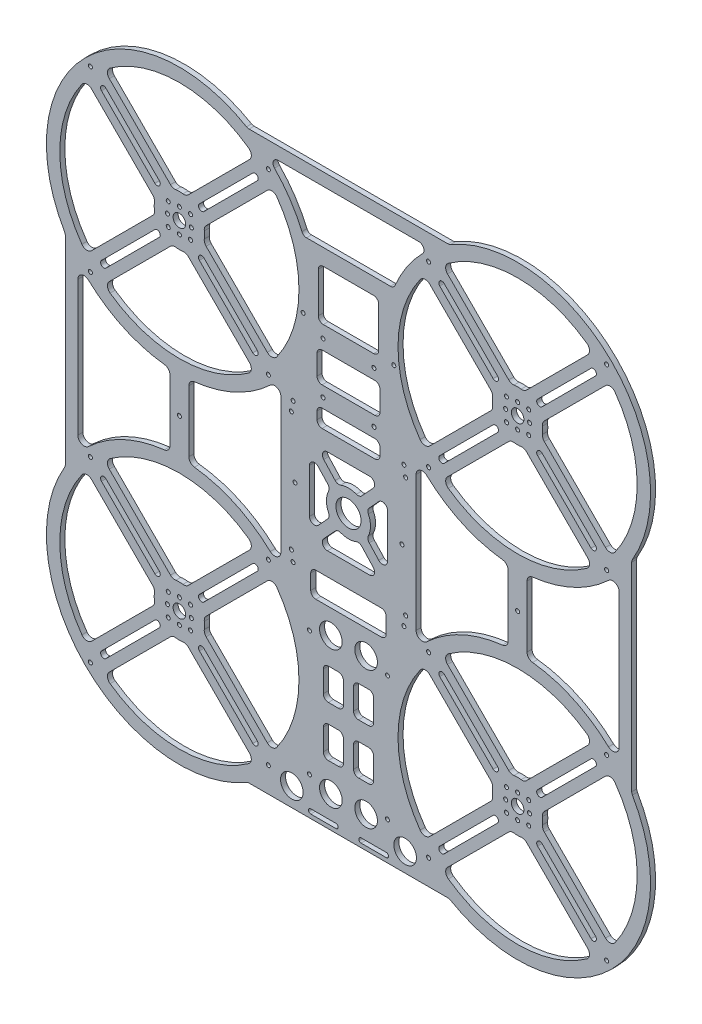
from build123d import *

# Parameters (mm, degrees)
SKETCH_1_W           = 310
SKETCH_1_H           = 310
EXTRUDE_1_DEPTH      = 4
SKETCH_2_R           = 5
SKETCH_2_R_2         = 1.6
CUT_EXTRUDE_2_DEPTH  = 4
SKETCH_3_R           = 2.5
CUT_EXTRUDE_3_DEPTH  = 4
SKETCH_4_R           = 10
CUT_EXTRUDE_4_DEPTH  = 10
SKETCH_5_R           = 1.6
CUT_EXTRUDE_5_DEPTH  = 10
SKETCH_7_R           = 1.6
CUT_EXTRUDE_7_DEPTH  = 10
EXTRUDE_2_DEPTH      = 4
EXTRUDE_3_DEPTH      = 4
CUT_EXTRUDE_12_DEPTH = 6
EXTRUDE_4_DEPTH      = 4
SKETCH_19_R          = 1.6
CUT_EXTRUDE_13_DEPTH = 6
SKETCH_20_R          = 1.6
CUT_EXTRUDE_14_DEPTH = 10
CUT_EXTRUDE_15_DEPTH = 10
FILLET_1_R           = 5
CUT_EXTRUDE_16_DEPTH = 10
CUT_EXTRUDE_17_DEPTH = 5
SKETCH_26_R          = 1.6
CUT_EXTRUDE_18_DEPTH = 10
SKETCH_27_R          = 1.6
SKETCH_27_R_2        = 9
SKETCH_27_W          = 40
SKETCH_27_H          = 25
SKETCH_27_W_2        = 60
SKETCH_27_H_2        = 20
CUT_EXTRUDE_19_DEPTH = 10
FILLET_3_R           = 4
CUT_EXTRUDE_21_DEPTH = 10
SKETCH_30_W          = 8
SKETCH_30_H          = 65
EXTRUDE_5_DEPTH      = 4
FILLET_4_R           = 4
SKETCH_31_W          = 50
SKETCH_31_H          = 24
SKETCH_31_W_2        = 48
SKETCH_31_H_2        = 40
SKETCH_31_H_3        = 14
CUT_EXTRUDE_22_DEPTH = 4
FILLET_5_R           = 4
FILLET_6_R           = 4
FILLET_7_R           = 4
FILLET_8_R           = 4
SKETCH_32_R          = 1.6
CUT_EXTRUDE_23_DEPTH = 10
SKETCH_33_R          = 1.6
CUT_EXTRUDE_24_DEPTH = 4


with BuildPart() as part:
    # 草图1 → 凸台-拉伸1 (new body)
    with BuildSketch(Plane.XY):
        Rectangle(SKETCH_1_W, SKETCH_1_H)
    extrude(amount=EXTRUDE_1_DEPTH)

    # 草图2 → 切除-拉伸2 (cut)
    with BuildSketch(Plane.XY.offset(4)):
        with Locations((-134.350288425, -134.350288425)):
            Circle(SKETCH_2_R)
        with Locations((-134.350288425, -143.850288425)):
            Circle(SKETCH_2_R_2)
        with Locations((-143.850288425, -134.350288425)):
            Circle(SKETCH_2_R_2)
        with Locations((-134.350288425, -124.850288425)):
            Circle(SKETCH_2_R_2)
        with Locations((-124.850288425, -134.350288425)):
            Circle(SKETCH_2_R_2)
        with Locations(Location((124.850288425, -134.350288425, 0), (0, 0, 180))):
            Circle(SKETCH_2_R_2)
        with Locations(Location((134.350288425, -124.850288425, 0), (0, 0, 180))):
            Circle(SKETCH_2_R_2)
        with Locations(Location((143.850288425, -134.350288425, 0), (0, 0, 180))):
            Circle(SKETCH_2_R_2)
        with Locations(Location((134.350288425, -143.850288425, 0), (0, 0, 180))):
            Circle(SKETCH_2_R_2)
        with Locations(Location((134.350288425, -134.350288425, 0), (0, 0, 180))):
            Circle(SKETCH_2_R)
        with Locations((134.350288425, 134.350288425)):
            Circle(SKETCH_2_R)
        with Locations((134.350288425, 143.850288425)):
            Circle(SKETCH_2_R_2)
        with Locations((143.850288425, 134.350288425)):
            Circle(SKETCH_2_R_2)
        with Locations((134.350288425, 124.850288425)):
            Circle(SKETCH_2_R_2)
        with Locations((124.850288425, 134.350288425)):
            Circle(SKETCH_2_R_2)
        with Locations(Location((-124.850288425, 134.350288425, 0), (0, 0, 180))):
            Circle(SKETCH_2_R_2)
        with Locations(Location((-134.350288425, 124.850288425, 0), (0, 0, 180))):
            Circle(SKETCH_2_R_2)
        with Locations(Location((-143.850288425, 134.350288425, 0), (0, 0, 180))):
            Circle(SKETCH_2_R_2)
        with Locations(Location((-134.350288425, 143.850288425, 0), (0, 0, 180))):
            Circle(SKETCH_2_R_2)
        with Locations(Location((-134.350288425, 134.350288425, 0), (0, 0, 180))):
            Circle(SKETCH_2_R)
    extrude(amount=-CUT_EXTRUDE_2_DEPTH, mode=Mode.SUBTRACT)

    # 草图3 → 切除-拉伸3 (cut)
    with BuildSketch(Plane.XY.offset(4)):
        Circle(SKETCH_3_R)
    extrude(amount=-CUT_EXTRUDE_3_DEPTH, mode=Mode.SUBTRACT)

    # 草图4 → 切除-拉伸4 (cut)
    with BuildSketch(Plane.XY.offset(4)):
        Circle(SKETCH_4_R)
    extrude(amount=-CUT_EXTRUDE_4_DEPTH, mode=Mode.SUBTRACT)

    # 草图5 → 切除-拉伸5 (cut)
    with BuildSketch(Plane.XY.offset(4)):
        with Locations((-42.5, 0)):
            Circle(SKETCH_5_R)
        with Locations((42.5, 0)):
            Circle(SKETCH_5_R)
    extrude(amount=-CUT_EXTRUDE_5_DEPTH, mode=Mode.SUBTRACT)

    # 草图7 → 切除-拉伸7 (cut)
    with BuildSketch(Plane.XY.offset(4)):
        with Locations((-45.4, 47.5)):
            Circle(SKETCH_7_R)
        with Locations((-45.4, -47.5)):
            Circle(SKETCH_7_R)
        with Locations((45.4, -47.5)):
            Circle(SKETCH_7_R)
        with Locations((45.4, 47.5)):
            Circle(SKETCH_7_R)
    extrude(amount=-CUT_EXTRUDE_7_DEPTH, mode=Mode.SUBTRACT)

    # 草图10 → 凸台-拉伸2 (add)
    with BuildSketch(Plane.XY.offset(4)):
        with BuildLine():
            ThreePointArc((-30.738267078, 155), (-209.05591591, 209.05591591), (-155, 30.738267078))
            Line((-155, 30.738267078), (-155, 41.621709164))
            ThreePointArc((-155, 41.621709164), (-201.525432638, 201.525432638), (-41.621709164, 155))
            Line((-41.621709164, 155), (-30.738267078, 155))
        make_face()
        with BuildLine():
            Line((-155, 41.621709164), (-155, 30.738267078))
            ThreePointArc((-155, 30.738267078), (-67.341984896, 52.669514593), (-28.700576851, 134.350288425))
            ThreePointArc((-28.700576851, 134.350288425), (-29.211233534, 144.725291673), (-30.738267078, 155))
            Line((-30.738267078, 155), (-41.621709164, 155))
            ThreePointArc((-41.621709164, 155), (-39.919850986, 144.737419168), (-39.350288425, 134.350288425))
            ThreePointArc((-39.350288425, 134.350288425), (-74.922696347, 60.233075176), (-155, 41.621709164))
        make_face()
        with BuildLine():
            ThreePointArc((-155, -30.738267078), (-209.05591591, -209.05591591), (-30.738267078, -155))
            Line((-30.738267078, -155), (-41.621709164, -155))
            ThreePointArc((-41.621709164, -155), (-201.525432638, -201.525432638), (-155, -41.621709164))
            Line((-155, -41.621709164), (-155, -30.738267078))
        make_face()
        with BuildLine():
            Line((-41.621709164, -155), (-30.738267078, -155))
            ThreePointArc((-30.738267078, -155), (-29.211233534, -144.725291673), (-28.700576851, -134.350288425))
            ThreePointArc((-28.700576851, -134.350288425), (-67.341984896, -52.669514593), (-155, -30.738267078))
            Line((-155, -30.738267078), (-155, -41.621709164))
            ThreePointArc((-155, -41.621709164), (-74.922696347, -60.233075176), (-39.350288425, -134.350288425))
            ThreePointArc((-39.350288425, -134.350288425), (-39.919850986, -144.737419168), (-41.621709164, -155))
        make_face()
        with BuildLine():
            ThreePointArc((229.350288425, -134.350288425), (144.737419168, -228.780725864), (41.621709164, -155))
            Line((41.621709164, -155), (30.738267078, -155))
            ThreePointArc((30.738267078, -155), (144.725291673, -239.489343317), (240, -134.350288425))
            ThreePointArc((240, -134.350288425), (216.031062258, -67.341984896), (155, -30.738267078))
            Line((155, -30.738267078), (155, -41.621709164))
            ThreePointArc((155, -41.621709164), (208.467501674, -74.922696347), (229.350288425, -134.350288425))
        make_face()
        with BuildLine():
            Line((30.738267078, -155), (41.621709164, -155))
            ThreePointArc((41.621709164, -155), (67.175144213, -67.175144213), (155, -41.621709164))
            Line((155, -41.621709164), (155, -30.738267078))
            ThreePointArc((155, -30.738267078), (59.644660941, -59.644660941), (30.738267078, -155))
        make_face()
        with BuildLine():
            ThreePointArc((30.738267078, 155), (59.644660941, 59.644660941), (155, 30.738267078))
            Line((155, 30.738267078), (155, 41.621709164))
            ThreePointArc((155, 41.621709164), (67.175144213, 67.175144213), (41.621709164, 155))
            Line((41.621709164, 155), (30.738267078, 155))
        make_face()
        with BuildLine():
            Line((155, 41.621709164), (155, 30.738267078))
            ThreePointArc((155, 30.738267078), (216.031062258, 67.341984896), (240, 134.350288425))
            ThreePointArc((240, 134.350288425), (144.725291673, 239.489343317), (30.738267078, 155))
            Line((30.738267078, 155), (41.621709164, 155))
            ThreePointArc((41.621709164, 155), (144.737419168, 228.780725864), (229.350288425, 134.350288425))
            ThreePointArc((229.350288425, 134.350288425), (208.467501674, 74.922696347), (155, 41.621709164))
        make_face()
    extrude(amount=-EXTRUDE_2_DEPTH)

    # 草图11 → 凸台-拉伸3 (add)
    with BuildSketch(Plane.XY.offset(4)):
        with BuildLine():
            Line((-225, 80.087120924), (-225, -80.087120924))
            ThreePointArc((-225, -80.087120924), (-195.224895137, -48.001323096), (-155, -30.738267078))
            Line((-155, -30.738267078), (-155, 30.738267078))
            ThreePointArc((-155, 30.738267078), (-195.224895137, 48.001323096), (-225, 80.087120924))
        make_face()
        with BuildLine():
            Line((30.738267078, -155), (-30.738267078, -155))
            ThreePointArc((-30.738267078, -155), (-48.001323096, -195.224895137), (-80.087120924, -225))
            Line((-80.087120924, -225), (80.087120924, -225))
            ThreePointArc((80.087120924, -225), (48.001323096, -195.224895137), (30.738267078, -155))
        make_face()
        with BuildLine():
            Line((225, -80.087120924), (225, 80.087120924))
            ThreePointArc((225, 80.087120924), (195.224895137, 48.001323096), (155, 30.738267078))
            Line((155, 30.738267078), (155, -30.738267078))
            ThreePointArc((155, -30.738267078), (195.224895137, -48.001323096), (225, -80.087120924))
        make_face()
        with BuildLine():
            Line((-30.738267078, 155), (30.738267078, 155))
            ThreePointArc((30.738267078, 155), (48.001323096, 195.224895137), (80.087120924, 225))
            Line((80.087120924, 225), (-80.087120924, 225))
            ThreePointArc((-80.087120924, 225), (-48.001323096, 195.224895137), (-30.738267078, 155))
        make_face()
    extrude(amount=-EXTRUDE_3_DEPTH)

    # 草图12 → 切除-拉伸12 (cut)
    with BuildSketch(Plane.XY.offset(4)):
        with BuildLine():
            Line((-74.619410158, -60.477274534), (-129.173907523, -115.0317719))
            ThreePointArc((-129.173907523, -115.0317719), (-148.492424049, -148.492424049), (-115.0317719, -129.173907523))
            Line((-115.0317719, -129.173907523), (-60.477274534, -74.619410158))
            ThreePointArc((-60.477274534, -74.619410158), (-201.525432638, -201.525432638), (-74.619410158, -60.477274534))
        make_face()
        with BuildLine():
            Line((74.619410158, -60.477274534), (129.173907523, -115.0317719))
            ThreePointArc((129.173907523, -115.0317719), (148.492424049, -148.492424049), (115.0317719, -129.173907523))
            Line((115.0317719, -129.173907523), (60.477274534, -74.619410158))
            ThreePointArc((60.477274534, -74.619410158), (201.525432638, -201.525432638), (74.619410158, -60.477274534))
        make_face()
        with BuildLine():
            Line((60.477274534, 74.619410158), (115.0317719, 129.173907523))
            ThreePointArc((115.0317719, 129.173907523), (148.492424049, 148.492424049), (129.173907523, 115.0317719))
            Line((129.173907523, 115.0317719), (74.619410158, 60.477274534))
            ThreePointArc((74.619410158, 60.477274534), (201.525432638, 201.525432638), (60.477274534, 74.619410158))
        make_face()
        with BuildLine():
            Line((-74.619410158, 60.477274534), (-129.173907523, 115.0317719))
            ThreePointArc((-129.173907523, 115.0317719), (-148.492424049, 148.492424049), (-115.0317719, 129.173907523))
            Line((-115.0317719, 129.173907523), (-60.477274534, 74.619410158))
            ThreePointArc((-60.477274534, 74.619410158), (-201.525432638, 201.525432638), (-74.619410158, 60.477274534))
        make_face()
    extrude(amount=-CUT_EXTRUDE_12_DEPTH, mode=Mode.SUBTRACT)

    # 草图15 → 凸台-拉伸4 (add)
    with BuildSketch(Plane.XY.offset(4)):
        with BuildLine():
            Line((194.081166693, -60.477274534), (139.526669327, -115.0317719))
            ThreePointArc((139.526669327, -115.0317719), (148.492424049, -120.208152802), (153.668804951, -129.173907523))
            Line((153.668804951, -129.173907523), (208.223302317, -74.619410158))
            ThreePointArc((208.223302317, -74.619410158), (201.525432638, -67.175144213), (194.081166693, -60.477274534))
        make_face()
        with BuildLine():
            Line((208.223302317, -194.081166693), (153.668804951, -139.526669327))
            ThreePointArc((153.668804951, -139.526669327), (148.492424049, -148.492424049), (139.526669327, -153.668804951))
            Line((139.526669327, -153.668804951), (194.081166693, -208.223302317))
            ThreePointArc((194.081166693, -208.223302317), (201.525432638, -201.525432638), (208.223302317, -194.081166693))
        make_face()
        with BuildLine():
            Line((74.619410158, -208.223302317), (129.173907523, -153.668804951))
            ThreePointArc((129.173907523, -153.668804951), (120.208152802, -148.492424049), (115.0317719, -139.526669327))
            Line((115.0317719, -139.526669327), (60.477274534, -194.081166693))
            ThreePointArc((60.477274534, -194.081166693), (67.175144213, -201.525432638), (74.619410158, -208.223302317))
        make_face()
        with BuildLine():
            Line((-60.477274534, -194.081166693), (-115.0317719, -139.526669327))
            ThreePointArc((-115.0317719, -139.526669327), (-120.208152802, -148.492424049), (-129.173907523, -153.668804951))
            Line((-129.173907523, -153.668804951), (-74.619410158, -208.223302317))
            ThreePointArc((-74.619410158, -208.223302317), (-67.175144213, -201.525432638), (-60.477274534, -194.081166693))
        make_face()
        with BuildLine():
            Line((-194.081166693, -208.223302317), (-139.526669327, -153.668804951))
            ThreePointArc((-139.526669327, -153.668804951), (-148.492424049, -148.492424049), (-153.668804951, -139.526669327))
            Line((-153.668804951, -139.526669327), (-208.223302317, -194.081166693))
            ThreePointArc((-208.223302317, -194.081166693), (-201.525432638, -201.525432638), (-194.081166693, -208.223302317))
        make_face()
        with BuildLine():
            Line((-208.223302317, -74.619410158), (-153.668804951, -129.173907523))
            ThreePointArc((-153.668804951, -129.173907523), (-148.492424049, -120.208152802), (-139.526669327, -115.0317719))
            Line((-139.526669327, -115.0317719), (-194.081166693, -60.477274534))
            ThreePointArc((-194.081166693, -60.477274534), (-201.525432638, -67.175144213), (-208.223302317, -74.619410158))
        make_face()
        with BuildLine():
            Line((-194.081166693, 60.477274534), (-139.526669327, 115.0317719))
            ThreePointArc((-139.526669327, 115.0317719), (-148.492424049, 120.208152802), (-153.668804951, 129.173907523))
            Line((-153.668804951, 129.173907523), (-208.223302317, 74.619410158))
            ThreePointArc((-208.223302317, 74.619410158), (-201.525432638, 67.175144213), (-194.081166693, 60.477274534))
        make_face()
        with BuildLine():
            Line((-208.223302317, 194.081166693), (-153.668804951, 139.526669327))
            ThreePointArc((-153.668804951, 139.526669327), (-148.492424049, 148.492424049), (-139.526669327, 153.668804951))
            Line((-139.526669327, 153.668804951), (-194.081166693, 208.223302317))
            ThreePointArc((-194.081166693, 208.223302317), (-201.525432638, 201.525432638), (-208.223302317, 194.081166693))
        make_face()
        with BuildLine():
            Line((-74.619410158, 208.223302317), (-129.173907523, 153.668804951))
            ThreePointArc((-129.173907523, 153.668804951), (-120.208152802, 148.492424049), (-115.0317719, 139.526669327))
            Line((-115.0317719, 139.526669327), (-60.477274534, 194.081166693))
            ThreePointArc((-60.477274534, 194.081166693), (-67.175144213, 201.525432638), (-74.619410158, 208.223302317))
        make_face()
        with BuildLine():
            Line((60.477274534, 194.081166693), (115.0317719, 139.526669327))
            ThreePointArc((115.0317719, 139.526669327), (120.208152802, 148.492424049), (129.173907523, 153.668804951))
            Line((129.173907523, 153.668804951), (74.619410158, 208.223302317))
            ThreePointArc((74.619410158, 208.223302317), (67.175144213, 201.525432638), (60.477274534, 194.081166693))
        make_face()
        with BuildLine():
            Line((194.081166693, 208.223302317), (139.526669327, 153.668804951))
            ThreePointArc((139.526669327, 153.668804951), (148.492424049, 148.492424049), (153.668804951, 139.526669327))
            Line((153.668804951, 139.526669327), (208.223302317, 194.081166693))
            ThreePointArc((208.223302317, 194.081166693), (201.525432638, 201.525432638), (194.081166693, 208.223302317))
        make_face()
        with BuildLine():
            Line((208.223302317, 74.619410158), (153.668804951, 129.173907523))
            ThreePointArc((153.668804951, 129.173907523), (148.492424049, 120.208152802), (139.526669327, 115.0317719))
            Line((139.526669327, 115.0317719), (194.081166693, 60.477274534))
            ThreePointArc((194.081166693, 60.477274534), (201.525432638, 67.175144213), (208.223302317, 74.619410158))
        make_face()
    extrude(amount=-EXTRUDE_4_DEPTH)

    # 草图19 → 切除-拉伸13 (cut)
    with BuildSketch(Plane.XY.offset(4)):
        with Locations((63.639610307, -63.639610307)):
            Circle(SKETCH_19_R)
        with Locations((205.060966544, -63.639610307)):
            Circle(SKETCH_19_R)
        with Locations((205.060966544, -205.060966544)):
            Circle(SKETCH_19_R)
        with Locations((63.639610307, -205.060966544)):
            Circle(SKETCH_19_R)
        with Locations((-63.639610307, -205.060966544)):
            Circle(SKETCH_19_R)
        with Locations((-205.060966544, -205.060966544)):
            Circle(SKETCH_19_R)
        with Locations((-205.060966544, -63.639610307)):
            Circle(SKETCH_19_R)
        with Locations((-63.639610307, -63.639610307)):
            Circle(SKETCH_19_R)
        with Locations((-63.639610307, 63.639610307)):
            Circle(SKETCH_19_R)
        with Locations((-205.060966544, 63.639610307)):
            Circle(SKETCH_19_R)
        with Locations((-205.060966544, 205.060966544)):
            Circle(SKETCH_19_R)
        with Locations((-63.639610307, 205.060966544)):
            Circle(SKETCH_19_R)
        with Locations((63.639610307, 205.060966544)):
            Circle(SKETCH_19_R)
        with Locations((205.060966544, 205.060966544)):
            Circle(SKETCH_19_R)
        with Locations((205.060966544, 63.639610307)):
            Circle(SKETCH_19_R)
        with Locations((63.639610307, 63.639610307)):
            Circle(SKETCH_19_R)
    extrude(amount=-CUT_EXTRUDE_13_DEPTH, mode=Mode.SUBTRACT)

    # 草图20 → 切除-拉伸14 (cut)
    with BuildSketch(Plane.XY.offset(4)):
        with Locations((-31, -195)):
            Circle(SKETCH_20_R)
        with Locations((-31, -96)):
            Circle(SKETCH_20_R)
        with Locations((31, -195)):
            Circle(SKETCH_20_R)
        with Locations((31, -96)):
            Circle(SKETCH_20_R)
    extrude(amount=-CUT_EXTRUDE_14_DEPTH, mode=Mode.SUBTRACT)

    # 草图21 → 切除-拉伸15 (cut)
    with BuildSketch(Plane.XY.offset(4)):
        with BuildLine():
            Line((-215, 66.104515086), (-215, -66.104515086))
            ThreePointArc((-215, -66.104515086), (-182.176948203, -40.145871489), (-141.850288425, -28.967122997))
            Line((-141.850288425, -28.967122997), (-141.850288425, 28.967122997))
            ThreePointArc((-141.850288425, 28.967122997), (-182.176948203, 40.145871489), (-215, 66.104515086))
        make_face()
        with BuildLine():
            Line((-53.700576851, 66.104515086), (-53.700576851, -66.104515086))
            ThreePointArc((-53.700576851, -66.104515086), (-86.523628648, -40.145871489), (-126.850288425, -28.967122997))
            Line((-126.850288425, -28.967122997), (-126.850288425, 28.967122997))
            ThreePointArc((-126.850288425, 28.967122997), (-86.523628648, 40.145871489), (-53.700576851, 66.104515086))
        make_face()
        with BuildLine():
            Line((126.850288425, 28.967122997), (126.850288425, -28.967122997))
            ThreePointArc((126.850288425, -28.967122997), (86.523628648, -40.145871489), (53.700576851, -66.104515086))
            Line((53.700576851, -66.104515086), (53.700576851, 66.104515086))
            ThreePointArc((53.700576851, 66.104515086), (86.523628648, 40.145871489), (126.850288425, 28.967122997))
        make_face()
        with BuildLine():
            Line((141.850288425, 28.967122997), (141.850288425, -28.967122997))
            ThreePointArc((141.850288425, -28.967122997), (182.176948203, -40.145871489), (215, -66.104515086))
            Line((215, -66.104515086), (215, 66.104515086))
            ThreePointArc((215, 66.104515086), (182.176948203, 40.145871489), (141.850288425, 28.967122997))
        make_face()
    extrude(amount=-CUT_EXTRUDE_15_DEPTH, mode=Mode.SUBTRACT)

    # 圆角1
    # the kernel refuses this fillet: 5 mm, written as the material it adds along each edge
    with BuildSketch(Plane(origin=(-74.619410158, -60.477274534, 4), x_dir=(-0.7967219110090882, 0.6043460900163303, 0), z_dir=(0, 0, -1)), Plane(origin=(-60.477274534, 74.619410158, 4), x_dir=(0.6043460900163303, 0.7967219110090882, 0), z_dir=(0, 0, -1)), Plane(origin=(74.619410158, 60.477274534, 4), x_dir=(0.7967219110090923, -0.604346090016325, 0), z_dir=(0, 0, -1)), Plane(origin=(60.477274534, -74.619410158, 4), x_dir=(-0.6043460900163312, -0.7967219110090877, 0), z_dir=(0, 0, -1)), Plane(origin=(194.081166693, -60.477274534, 4), x_dir=(-0.7967219110091349, 0.6043460900162688, 0), z_dir=(0, 0, -1)), Plane(origin=(208.223302317, -194.081166693, 4), x_dir=(0.6043460900162626, 0.7967219110091395, 0), z_dir=(0, 0, -1)), Plane(origin=(74.619410158, -208.223302317, 4), x_dir=(0.7967219110091152, -0.604346090016295, 0), z_dir=(0, 0, -1)), Plane(origin=(-60.477274534, -194.081166693, 4), x_dir=(0.6043460900162643, 0.7967219110091384, 0), z_dir=(0, 0, -1)), Plane(origin=(-194.081166693, -208.223302317, 4), x_dir=(0.7967219110091337, -0.6043460900162704, 0), z_dir=(0, 0, -1)), Plane(origin=(-208.223302317, -74.619410158, 4), x_dir=(-0.6043460900163309, -0.796721911009088, 0), z_dir=(0, 0, -1)), Plane(origin=(-194.081166693, 60.477274534, 4), x_dir=(0.796721911009097, -0.6043460900163189, 0), z_dir=(0, 0, -1)), Plane(origin=(-208.223302317, 194.081166693, 4), x_dir=(-0.6043460900162841, -0.7967219110091232, 0), z_dir=(0, 0, -1)), Plane(origin=(-74.619410158, 208.223302317, 4), x_dir=(-0.796721911009138, 0.6043460900162645, 0), z_dir=(0, 0, -1)), Plane(origin=(60.477274534, 194.081166693, 4), x_dir=(-0.6043460900163381, -0.7967219110090824, 0), z_dir=(0, 0, -1)), Plane(origin=(194.081166693, 208.223302317, 4), x_dir=(-0.796721911009126, 0.6043460900162804, 0), z_dir=(0, 0, -1)), Plane(origin=(208.223302317, 74.619410158, 4), x_dir=(0.6043460900162649, 0.7967219110091378, 0), z_dir=(0, 0, -1))) as fillet_1_piece_1:
        with BuildLine():
            CenterArc((5.733115681, -4.997598502), FILLET_1_R, 88.224130096, 99.594068227)
            Line((0.779592259, -5.67774974), (0, 0))
            ThreePointArc((0, 0), (2.944032377, 0.045628466), (5.888064753, 0))
        make_face()
    extrude(amount=4)
    with BuildSketch(Plane(origin=(-129.173907523, -115.0317719, 4), x_dir=(0.7071067811865476, 0.7071067811865476, 0), z_dir=(0, 0, -1)), Plane(origin=(-115.0317719, 129.173907523, 4), x_dir=(0.7071067811865476, -0.7071067811865476, 0), z_dir=(0, 0, -1)), Plane(origin=(129.173907523, 115.0317719, 4), x_dir=(-0.7071067811865476, -0.7071067811865476, 0), z_dir=(0, 0, -1)), Plane(origin=(115.0317719, -129.173907523, 4), x_dir=(-0.7071067811865449, 0.7071067811865501, 0), z_dir=(0, 0, -1))) as fillet_1_piece_2:
        with BuildLine():
            CenterArc((2.679491924, -5), FILLET_1_R, 90, 53.130102354)
            ThreePointArc((-1.320508076, -2), (-0.630269473, -1.01979743), (0, 0))
            Line((0, 0), (2.679491924, 0))
        make_face()
    extrude(amount=4)
    with BuildSketch(Plane(origin=(-115.0317719, -129.173907523, 4), x_dir=(0.7071067811865529, 0.7071067811865422, 0), z_dir=(0, 0, -1)), Plane(origin=(-129.173907523, 115.0317719, 4), x_dir=(0.7071067811865448, -0.7071067811865501, 0), z_dir=(0, 0, -1)), Plane(origin=(115.0317719, 129.173907523, 4), x_dir=(-0.7071067811865529, -0.7071067811865422, 0), z_dir=(0, 0, -1)), Plane(origin=(129.173907523, -115.0317719, 4), x_dir=(-0.7071067811865476, 0.7071067811865476, 0), z_dir=(0, 0, -1)), Plane(origin=(-115.0317719, 139.526669327, 4), x_dir=(0.7071067811865608, 0.7071067811865343, 0), z_dir=(0, 0, -1))) as fillet_1_piece_3:
        with BuildLine():
            CenterArc((2.679491924, 5), FILLET_1_R, 216.869897646, 53.130102354)
            ThreePointArc((-1.320508076, 2), (-0.630269473, 1.01979743), (0, 0))
            Line((0, 0), (2.679491924, 0))
        make_face()
    extrude(amount=4)
    with BuildSketch(Plane(origin=(-60.477274534, -74.619410158, 4), x_dir=(0.6043460900163297, -0.7967219110090887, 0), z_dir=(0, 0, -1)), Plane(origin=(-74.619410158, 60.477274534, 4), x_dir=(-0.7967219110090935, -0.6043460900163236, 0), z_dir=(0, 0, -1)), Plane(origin=(60.477274534, 74.619410158, 4), x_dir=(-0.6043460900163317, 0.7967219110090873, 0), z_dir=(0, 0, -1)), Plane(origin=(74.619410158, -60.477274534, 4), x_dir=(0.7967219110090923, 0.604346090016325, 0), z_dir=(0, 0, -1)), Plane(origin=(208.223302317, -74.619410158, 4), x_dir=(0.6043460900162811, -0.7967219110091256, 0), z_dir=(0, 0, -1)), Plane(origin=(194.081166693, -208.223302317, 4), x_dir=(-0.7967219110091273, -0.6043460900162788, 0), z_dir=(0, 0, -1)), Plane(origin=(60.477274534, -194.081166693, 4), x_dir=(-0.6043460900163019, 0.7967219110091098, 0), z_dir=(0, 0, -1)), Plane(origin=(-74.619410158, -208.223302317, 4), x_dir=(-0.7967219110091455, -0.6043460900162549, 0), z_dir=(0, 0, -1)), Plane(origin=(-208.223302317, -194.081166693, 4), x_dir=(-0.6043460900162757, 0.7967219110091296, 0), z_dir=(0, 0, -1)), Plane(origin=(-194.081166693, -60.477274534, 4), x_dir=(0.7967219110090976, 0.6043460900163181, 0), z_dir=(0, 0, -1)), Plane(origin=(-208.223302317, 74.619410158, 4), x_dir=(-0.6043460900163242, 0.7967219110090928, 0), z_dir=(0, 0, -1)), Plane(origin=(-194.081166693, 208.223302317, 4), x_dir=(0.7967219110091238, 0.6043460900162835, 0), z_dir=(0, 0, -1)), Plane(origin=(-60.477274534, 194.081166693, 4), x_dir=(0.604346090016268, -0.7967219110091355, 0), z_dir=(0, 0, -1)), Plane(origin=(74.619410158, 208.223302317, 4), x_dir=(0.7967219110090917, 0.6043460900163258, 0), z_dir=(0, 0, -1)), Plane(origin=(208.223302317, 194.081166693, 4), x_dir=(0.6043460900162664, -0.7967219110091366, 0), z_dir=(0, 0, -1)), Plane(origin=(194.081166693, 60.477274534, 4), x_dir=(-0.7967219110091525, -0.6043460900162457, 0), z_dir=(0, 0, -1))) as fillet_1_piece_4:
        with BuildLine():
            CenterArc((5.733115681, 4.997598502), FILLET_1_R, 172.181801677, 99.594068227)
            Line((0.779592259, 5.67774974), (0, 0))
            ThreePointArc((0, 0), (2.944032377, -0.045628466), (5.888064753, 0))
        make_face()
    extrude(amount=4)
    with BuildSketch(Plane(origin=(153.668804951, -129.173907523, 4), x_dir=(0.20048037027259313, -0.9796977192661848, 0), z_dir=(0, 0, -1)), Plane(origin=(139.526669327, -153.668804951, 4), x_dir=(-0.9796977192661612, -0.20048037027270718, 0), z_dir=(0, 0, -1)), Plane(origin=(-129.173907523, -153.668804951, 4), x_dir=(-0.9796977192661944, -0.20048037027254526, 0), z_dir=(0, 0, -1)), Plane(origin=(-153.668804951, -139.526669327, 4), x_dir=(-0.200480370272568, 0.9796977192661898, 0), z_dir=(0, 0, -1)), Plane(origin=(-139.526669327, -115.0317719, 4), x_dir=(0.9796977192661748, 0.20048037027264123, 0), z_dir=(0, 0, -1)), Plane(origin=(-153.668804951, 129.173907523, 4), x_dir=(-0.20048037027270513, 0.9796977192661617, 0), z_dir=(0, 0, -1)), Plane(origin=(-139.526669327, 153.668804951, 4), x_dir=(0.9796977192661659, 0.20048037027268442, 0), z_dir=(0, 0, -1)), Plane(origin=(129.173907523, 153.668804951, 4), x_dir=(0.9796977192661748, 0.20048037027264123, 0), z_dir=(0, 0, -1)), Plane(origin=(153.668804951, 139.526669327, 4), x_dir=(0.20048037027250878, -0.979697719266202, 0), z_dir=(0, 0, -1)), Plane(origin=(139.526669327, 115.0317719, 4), x_dir=(-0.9796977192661965, -0.2004803702725349, 0), z_dir=(0, 0, -1))) as fillet_1_piece_5:
        with BuildLine():
            CenterArc((2.69618674, -4.991017335), FILLET_1_R, 93.434948823, 53.130102354)
            Line((-1.476372911, -2.236067977), (0, 0))
            ThreePointArc((0, 0), (1.198305218, -0.03593066), (2.396610435, 0))
        make_face()
    extrude(amount=4)
    with BuildSketch(Plane(origin=(139.526669327, -115.0317719, 4), x_dir=(-0.9796977192662006, 0.2004803702725155, 0), z_dir=(0, 0, -1)), Plane(origin=(153.668804951, -139.526669327, 4), x_dir=(0.20048037027249271, 0.9796977192662051, 0), z_dir=(0, 0, -1)), Plane(origin=(129.173907523, -153.668804951, 4), x_dir=(0.9796977192661716, -0.20048037027265728, 0), z_dir=(0, 0, -1)), Plane(origin=(-115.0317719, -139.526669327, 4), x_dir=(0.20048037027268442, 0.9796977192661659, 0), z_dir=(0, 0, -1)), Plane(origin=(-139.526669327, -153.668804951, 4), x_dir=(0.9796977192661739, -0.20048037027264562, 0), z_dir=(0, 0, -1)), Plane(origin=(-153.668804951, -129.173907523, 4), x_dir=(-0.20048037027269142, -0.9796977192661644, 0), z_dir=(0, 0, -1)), Plane(origin=(-139.526669327, 115.0317719, 4), x_dir=(0.9796977192661752, -0.20048037027263887, 0), z_dir=(0, 0, -1)), Plane(origin=(-153.668804951, 139.526669327, 4), x_dir=(-0.20048037027258173, -0.9796977192661869, 0), z_dir=(0, 0, -1)), Plane(origin=(-129.173907523, 153.668804951, 4), x_dir=(-0.9796977192661869, 0.20048037027258173, 0), z_dir=(0, 0, -1)), Plane(origin=(139.526669327, 153.668804951, 4), x_dir=(-0.9796977192661666, 0.20048037027268212, 0), z_dir=(0, 0, -1)), Plane(origin=(153.668804951, 129.173907523, 4), x_dir=(0.20048037027261822, 0.9796977192661797, 0), z_dir=(0, 0, -1))) as fillet_1_piece_6:
        with BuildLine():
            CenterArc((2.69618674, 4.991017335), FILLET_1_R, 213.434948823, 53.130102354)
            Line((-1.476372911, 2.236067977), (0, 0))
            ThreePointArc((0, 0), (1.198305218, 0.03593066), (2.396610435, 0))
        make_face()
    extrude(amount=4)
    with BuildSketch(Plane(origin=(115.0317719, -139.526669327, 4), x_dir=(-0.2004803702727988, 0.9796977192661427, 0), z_dir=(0, 0, -1))) as fillet_1_piece_7:
        with BuildLine():
            CenterArc((2.69618674, -4.991017335), FILLET_1_R, 93.434948823, 53.130102354)
            Line((-1.476372911, -2.236067978), (0, 0))
            ThreePointArc((0, 0), (1.198305218, -0.03593066), (2.396610435, 0))
        make_face()
    extrude(amount=4)
    with BuildSketch(Plane(origin=(115.0317719, 139.526669327, 4), x_dir=(-0.20048037027278273, -0.9796977192661459, 0), z_dir=(0, 0, -1))) as fillet_1_piece_8:
        with BuildLine():
            CenterArc((2.69618674, 4.991017335), FILLET_1_R, 213.434948823, 53.130102354)
            Line((-1.476372911, 2.236067978), (0, 0))
            ThreePointArc((0, 0), (1.198305218, 0.03593066), (2.396610435, 0))
        make_face()
    extrude(amount=4)
    with BuildSketch(Plane(origin=(141.850288425, 28.967122997, 4), x_dir=(0, -1, 0), z_dir=(0, 0, -1)), Plane(origin=(-126.850288425, 28.967122997, 4), x_dir=(0, -1, 0), z_dir=(0, 0, -1)), Plane(origin=(-141.850288425, -28.967122997, 4), x_dir=(0, 1, 0), z_dir=(0, 0, -1)), Plane(origin=(126.850288425, -28.967122997, 4), x_dir=(0, 1, 0), z_dir=(0, 0, -1))) as fillet_1_piece_9:
        with BuildLine():
            CenterArc((4.558222008, -5), FILLET_1_R, 90, 83.513499464)
            ThreePointArc((-0.409770492, -4.435154425), (-0.181510162, -2.219736871), (0, 0))
            Line((0, 0), (4.558222008, 0))
        make_face()
    extrude(amount=4)
    with BuildSketch(Plane(origin=(215, 66.104515086, 4), x_dir=(0, -1, 0), z_dir=(0, 0, -1))) as fillet_1_piece_10:
        with BuildLine():
            CenterArc((12.503714648, 5), FILLET_1_R, 136.867606569, 133.132393431)
            ThreePointArc((8.854835367, 8.418432389), (4.549214087, 4.081105989), (0, 0))
            Line((0, 0), (12.503714648, 0))
        make_face()
    extrude(amount=4)
    with BuildSketch(Plane(origin=(215, -66.104515086, 4), x_dir=(0, 1, 0), z_dir=(0, 0, -1)), Plane(origin=(-215, 66.104515086, 4), x_dir=(0, -1, 0), z_dir=(0, 0, -1))) as fillet_1_piece_11:
        with BuildLine():
            CenterArc((12.503714648, -5), FILLET_1_R, 90, 133.132393431)
            ThreePointArc((8.854835367, -8.418432389), (4.549214087, -4.081105989), (0, 0))
            Line((0, 0), (12.503714648, 0))
        make_face()
    extrude(amount=4)
    with BuildSketch(Plane(origin=(141.850288425, -28.967122997, 4), x_dir=(0.9957590389908278, -0.09199965363012458, 0), z_dir=(0, 0, -1)), Plane(origin=(-126.850288425, -28.967122997, 4), x_dir=(0.995759038990828, -0.0919996536301237, 0), z_dir=(0, 0, -1)), Plane(origin=(126.850288425, 28.967122997, 4), x_dir=(-0.9957590389908271, 0.09199965363013249, 0), z_dir=(0, 0, -1))) as fillet_1_piece_12:
        with BuildLine():
            CenterArc((4.559440349, -4.998889034), FILLET_1_R, 91.207844363, 83.513499464)
            Line((-0.419354846, -4.538890766), (0, 0))
            ThreePointArc((0, 0), (2.227021925, -0.023474639), (4.454043851, 0))
        make_face()
    extrude(amount=4)
    with BuildSketch(Plane(origin=(-53.700576851, 66.104515086, 4), x_dir=(-0.6890221122427271, -0.7247403182109926, 0), z_dir=(0, 0, -1)), Plane(origin=(-215, -66.104515086, 4), x_dir=(0.6890221122427268, 0.7247403182109928, 0), z_dir=(0, 0, -1)), Plane(origin=(53.700576851, -66.104515086, 4), x_dir=(0.6890221122427213, 0.724740318210998, 0), z_dir=(0, 0, -1))) as fillet_1_piece_13:
        with BuildLine():
            CenterArc((12.507056694, -4.991634286), FILLET_1_R, 93.314856225, 133.132393431)
            Line((9.061946133, -8.615335877), (0, 0))
            ThreePointArc((0, 0), (6.108971134, -0.176767046), (12.217942268, 0))
        make_face()
    extrude(amount=4)
    with BuildSketch(Plane(origin=(-53.700576851, -66.104515086, 4), x_dir=(-0.6890221122427247, 0.7247403182109947, 0), z_dir=(0, 0, -1)), Plane(origin=(53.700576851, 66.104515086, 4), x_dir=(0.6890221122427295, -0.7247403182109904, 0), z_dir=(0, 0, -1))) as fillet_1_piece_14:
        with BuildLine():
            CenterArc((12.507056694, 4.991634286), FILLET_1_R, 133.552750344, 133.132393431)
            Line((9.061946133, 8.615335877), (0, 0))
            ThreePointArc((0, 0), (6.108971134, 0.176767046), (12.217942268, 0))
        make_face()
    extrude(amount=4)
    with BuildSketch(Plane(origin=(-141.850288425, 28.967122997, 4), x_dir=(0, -1, 0), z_dir=(0, 0, -1))) as fillet_1_piece_15:
        with BuildLine():
            CenterArc((4.558222008, 5), FILLET_1_R, 186.486500536, 83.513499464)
            ThreePointArc((-0.409770492, 4.435154425), (-0.181510162, 2.219736871), (0, 0))
            Line((0, 0), (4.558222008, 0))
        make_face()
    extrude(amount=4)

    # 草图24 → 切除-拉伸16 (cut)
    with BuildSketch(Plane.XY.offset(4)):
        with BuildLine():
            Line((-196.222131779, -192.686597873), (-153.795724908, -150.260191002))
            ThreePointArc((-153.795724908, -150.260191002), (-150.260191002, -150.260191002), (-150.260191002, -153.795724908))
            Line((-150.260191002, -153.795724908), (-192.686597873, -196.222131779))
            ThreePointArc((-192.686597873, -196.222131779), (-196.222131779, -196.222131779), (-196.222131779, -192.686597873))
        make_face()
        with BuildLine():
            Line((-196.222131779, -76.013978978), (-153.795724908, -118.440385849))
            ThreePointArc((-153.795724908, -118.440385849), (-150.260191002, -118.440385849), (-150.260191002, -114.904851943))
            Line((-150.260191002, -114.904851943), (-192.686597873, -72.478445072))
            ThreePointArc((-192.686597873, -72.478445072), (-196.222131779, -72.478445072), (-196.222131779, -76.013978978))
        make_face()
        with BuildLine():
            Line((-76.013978978, -72.478445072), (-118.440385849, -114.904851943))
            ThreePointArc((-118.440385849, -114.904851943), (-118.440385849, -118.440385849), (-114.904851943, -118.440385849))
            Line((-114.904851943, -118.440385849), (-72.478445072, -76.013978978))
            ThreePointArc((-72.478445072, -76.013978978), (-72.478445072, -72.478445072), (-76.013978978, -72.478445072))
        make_face()
        with BuildLine():
            Line((-72.478445072, -192.686597873), (-114.904851943, -150.260191002))
            ThreePointArc((-114.904851943, -150.260191002), (-118.440385849, -150.260191002), (-118.440385849, -153.795724908))
            Line((-118.440385849, -153.795724908), (-76.013978978, -196.222131779))
            ThreePointArc((-76.013978978, -196.222131779), (-72.478445072, -196.222131779), (-72.478445072, -192.686597873))
        make_face()
        with BuildLine():
            Line((76.013978978, -196.222131779), (118.440385849, -153.795724908))
            ThreePointArc((118.440385849, -153.795724908), (118.440385849, -150.260191002), (114.904851943, -150.260191002))
            Line((114.904851943, -150.260191002), (72.478445072, -192.686597873))
            ThreePointArc((72.478445072, -192.686597873), (72.478445072, -196.222131779), (76.013978978, -196.222131779))
        make_face()
        with BuildLine():
            Line((72.478445072, -76.013978978), (114.904851943, -118.440385849))
            ThreePointArc((114.904851943, -118.440385849), (118.440385849, -118.440385849), (118.440385849, -114.904851943))
            Line((118.440385849, -114.904851943), (76.013978978, -72.478445072))
            ThreePointArc((76.013978978, -72.478445072), (72.478445072, -72.478445072), (72.478445072, -76.013978978))
        make_face()
        with BuildLine():
            Line((192.686597873, -72.478445072), (150.260191002, -114.904851943))
            ThreePointArc((150.260191002, -114.904851943), (150.260191002, -118.440385849), (153.795724908, -118.440385849))
            Line((153.795724908, -118.440385849), (196.222131779, -76.013978978))
            ThreePointArc((196.222131779, -76.013978978), (196.222131779, -72.478445072), (192.686597873, -72.478445072))
        make_face()
        with BuildLine():
            Line((196.222131779, -192.686597873), (153.795724908, -150.260191002))
            ThreePointArc((153.795724908, -150.260191002), (150.260191002, -150.260191002), (150.260191002, -153.795724908))
            Line((150.260191002, -153.795724908), (192.686597873, -196.222131779))
            ThreePointArc((192.686597873, -196.222131779), (196.222131779, -196.222131779), (196.222131779, -192.686597873))
        make_face()
        with BuildLine():
            Line((196.222131779, 192.686597873), (153.795724908, 150.260191002))
            ThreePointArc((153.795724908, 150.260191002), (150.260191002, 150.260191002), (150.260191002, 153.795724908))
            Line((150.260191002, 153.795724908), (192.686597873, 196.222131779))
            ThreePointArc((192.686597873, 196.222131779), (196.222131779, 196.222131779), (196.222131779, 192.686597873))
        make_face()
        with BuildLine():
            Line((192.686597873, 72.478445072), (150.260191002, 114.904851943))
            ThreePointArc((150.260191002, 114.904851943), (150.260191002, 118.440385849), (153.795724908, 118.440385849))
            Line((153.795724908, 118.440385849), (196.222131779, 76.013978978))
            ThreePointArc((196.222131779, 76.013978978), (196.222131779, 72.478445072), (192.686597873, 72.478445072))
        make_face()
        with BuildLine():
            Line((72.478445072, 76.013978978), (114.904851943, 118.440385849))
            ThreePointArc((114.904851943, 118.440385849), (118.440385849, 118.440385849), (118.440385849, 114.904851943))
            Line((118.440385849, 114.904851943), (76.013978978, 72.478445072))
            ThreePointArc((76.013978978, 72.478445072), (72.478445072, 72.478445072), (72.478445072, 76.013978978))
        make_face()
        with BuildLine():
            Line((76.013978978, 196.222131779), (118.440385849, 153.795724908))
            ThreePointArc((118.440385849, 153.795724908), (118.440385849, 150.260191002), (114.904851943, 150.260191002))
            Line((114.904851943, 150.260191002), (72.478445072, 192.686597873))
            ThreePointArc((72.478445072, 192.686597873), (72.478445072, 196.222131779), (76.013978978, 196.222131779))
        make_face()
        with BuildLine():
            Line((-76.013978978, 196.222131779), (-118.440385849, 153.795724908))
            ThreePointArc((-118.440385849, 153.795724908), (-118.440385849, 150.260191002), (-114.904851943, 150.260191002))
            Line((-114.904851943, 150.260191002), (-72.478445072, 192.686597873))
            ThreePointArc((-72.478445072, 192.686597873), (-72.478445072, 196.222131779), (-76.013978978, 196.222131779))
        make_face()
        with BuildLine():
            Line((-72.478445072, 76.013978978), (-114.904851943, 118.440385849))
            ThreePointArc((-114.904851943, 118.440385849), (-118.440385849, 118.440385849), (-118.440385849, 114.904851943))
            Line((-118.440385849, 114.904851943), (-76.013978978, 72.478445072))
            ThreePointArc((-76.013978978, 72.478445072), (-72.478445072, 72.478445072), (-72.478445072, 76.013978978))
        make_face()
        with BuildLine():
            Line((-192.686597873, 72.478445072), (-150.260191002, 114.904851943))
            ThreePointArc((-150.260191002, 114.904851943), (-150.260191002, 118.440385849), (-153.795724908, 118.440385849))
            Line((-153.795724908, 118.440385849), (-196.222131779, 76.013978978))
            ThreePointArc((-196.222131779, 76.013978978), (-196.222131779, 72.478445072), (-192.686597873, 72.478445072))
        make_face()
        with BuildLine():
            Line((-196.222131779, 192.686597873), (-153.795724908, 150.260191002))
            ThreePointArc((-153.795724908, 150.260191002), (-150.260191002, 150.260191002), (-150.260191002, 153.795724908))
            Line((-150.260191002, 153.795724908), (-192.686597873, 196.222131779))
            ThreePointArc((-192.686597873, 196.222131779), (-196.222131779, 196.222131779), (-196.222131779, 192.686597873))
        make_face()
    extrude(amount=-CUT_EXTRUDE_16_DEPTH, mode=Mode.SUBTRACT)

    # 草图25 → 切除-拉伸17 (cut)
    with BuildSketch(Plane.XY.offset(4)):
        with BuildLine():
            Line((-30, -218.2), (-10, -218.2))
            ThreePointArc((-10, -218.2), (-8.2, -220), (-10, -221.8))
            Line((-10, -221.8), (-30, -221.8))
            ThreePointArc((-30, -221.8), (-31.8, -220), (-30, -218.2))
        make_face()
        with BuildLine():
            Line((30, -218.2), (10, -218.2))
            ThreePointArc((10, -218.2), (8.2, -220), (10, -221.8))
            Line((10, -221.8), (30, -221.8))
            ThreePointArc((30, -221.8), (31.8, -220), (30, -218.2))
        make_face()
    extrude(amount=-CUT_EXTRUDE_17_DEPTH, mode=Mode.SUBTRACT)

    # 草图26 → 切除-拉伸18 (cut)
    with BuildSketch(Plane.XY.offset(4)):
        with Locations((-20.25, 69.75)):
            Circle(SKETCH_26_R)
        with Locations((-20.25, 110.25)):
            Circle(SKETCH_26_R)
        with Locations((20.25, 69.75)):
            Circle(SKETCH_26_R)
        with Locations((20.25, 110.25)):
            Circle(SKETCH_26_R)
        with Locations((-36, 120)):
            Circle(SKETCH_26_R)
        with Locations((36, 120)):
            Circle(SKETCH_26_R)
    extrude(amount=-CUT_EXTRUDE_18_DEPTH, mode=Mode.SUBTRACT)

    # 草图27 → 切除-拉伸19 (cut)
    with BuildSketch(Plane.XY.offset(4)):
        with Locations((-134.350288425, 0)):
            Circle(SKETCH_27_R)
        with Locations((134.350288425, 0)):
            Circle(SKETCH_27_R)
        with Locations((-45, -210)):
            Circle(SKETCH_27_R_2)
        with Locations((-14, -200)):
            Circle(SKETCH_27_R_2)
        with Locations((14, -200)):
            Circle(SKETCH_27_R_2)
        with Locations((45, -210)):
            Circle(SKETCH_27_R_2)
        with Locations((14, -91)):
            Circle(SKETCH_27_R_2)
        with Locations((-14, -91)):
            Circle(SKETCH_27_R_2)
        with BuildLine():
            Line((-31, 27.752872524), (-31, -27.752872524))
            Line((-31, -27.752872524), (-14.484148574, -9.82137669))
            ThreePointArc((-14.484148574, -9.82137669), (-17.5, 0), (-14.484148574, 9.82137669))
            Line((-14.484148574, 9.82137669), (-31, 27.752872524))
        make_face()
        with Locations((0, -165.5)):
            Rectangle(SKETCH_27_W, SKETCH_27_H)
        with BuildLine():
            Line((-25.877645746, -34), (25.877645746, -34))
            Line((25.877645746, -34), (8.599787733, -15.241182728))
            ThreePointArc((8.599787733, -15.241182728), (0, -17.5), (-8.599787733, -15.241182728))
            Line((-8.599787733, -15.241182728), (-25.877645746, -34))
        make_face()
        with BuildLine():
            Line((31, -27.752872524), (14.484148574, -9.82137669))
            ThreePointArc((14.484148574, -9.82137669), (17.5, 0), (14.484148574, 9.82137669))
            Line((14.484148574, 9.82137669), (31, 27.752872524))
            Line((31, 27.752872524), (31, -27.752872524))
        make_face()
        with BuildLine():
            Line((25.877645746, 34), (8.599787733, 15.241182728))
            ThreePointArc((8.599787733, 15.241182728), (0, 17.5), (-8.599787733, 15.241182728))
            Line((-8.599787733, 15.241182728), (-25.877645746, 34))
            Line((-25.877645746, 34), (25.877645746, 34))
        make_face()
        with Locations((0, -125.5)):
            Rectangle(SKETCH_27_W, SKETCH_27_H)
        with Locations((0, -62)):
            Rectangle(SKETCH_27_W_2, SKETCH_27_H_2)
    extrude(amount=-CUT_EXTRUDE_19_DEPTH, mode=Mode.SUBTRACT)

    # 圆角3
    fillet_3_edges = [part.edges().sort_by_distance(p)[0] for p in [
        (-25.877645746, -34, 2),
        (-8.599787733, -15.241182728, 2),
        (8.599787733, -15.241182728, 2),
        (25.877645746, -34, 2),
        (31, 27.752872524, 2),
        (31, -27.752872524, 2),
        (14.484148574, -9.82137669, 2),
        (14.484148574, 9.82137669, 2),
        (-31, 27.752872524, 2),
        (-14.484148574, 9.82137669, 2),
        (-14.484148574, -9.82137669, 2),
        (-31, -27.752872524, 2),
        (-25.877645746, 34, 2),
        (25.877645746, 34, 2),
        (8.599787733, 15.241182728, 2),
        (-8.599787733, 15.241182728, 2),
        (30, -52, 2),
        (30, -72, 2),
        (-30, -72, 2),
        (-30, -52, 2),
        (20, -153, 2),
        (20, -178, 2),
        (-20, -178, 2),
        (-20, -153, 2),
        (-20, -138, 2),
        (-20, -113, 2),
        (20, -113, 2),
        (20, -138, 2),
    ]]
    fillet(fillet_3_edges, radius=FILLET_3_R)

    # 草图29 → 切除-拉伸21 (cut)
    with BuildSketch(Plane.XY.offset(4)):
        with BuildLine():
            Line((-36.023988022, 173), (36.023988022, 173))
            ThreePointArc((36.023988022, 173), (48.457541713, 195.866933474), (66.104515086, 215))
            Line((66.104515086, 215), (-66.104515086, 215))
            ThreePointArc((-66.104515086, 215), (-48.457541713, 195.866933474), (-36.023988022, 173))
        make_face()
    extrude(amount=-CUT_EXTRUDE_21_DEPTH, mode=Mode.SUBTRACT)

    # 草图30 → 凸台-拉伸5 (add)
    with BuildSketch(Plane.XY.offset(4)):
        with Locations((0, -145.5)):
            Rectangle(SKETCH_30_W, SKETCH_30_H)
    extrude(amount=-EXTRUDE_5_DEPTH)

    # 圆角4
    fillet_4_edges = [part.edges().sort_by_distance(p)[0] for p in [
        (-4, -153, 2),
        (4, -153, 2),
        (4, -113, 2),
        (-4, -178, 2),
        (4, -138, 2),
        (4, -178, 2),
        (-4, -138, 2),
        (-4, -113, 2),
    ]]
    fillet(fillet_4_edges, radius=FILLET_4_R)

    # 草图31 → 切除-拉伸22 (cut)
    with BuildSketch(Plane.XY.offset(4)):
        with Locations((0, 90)):
            Rectangle(SKETCH_31_W, SKETCH_31_H)
        with Locations((0, 140)):
            Rectangle(SKETCH_31_W_2, SKETCH_31_H_2)
        with Locations((0, 55)):
            Rectangle(SKETCH_31_W, SKETCH_31_H_3)
    extrude(amount=-CUT_EXTRUDE_22_DEPTH, mode=Mode.SUBTRACT)

    # 圆角5
    fillet_5_edges = [part.edges().sort_by_distance(p)[0] for p in [
        (24, 160, 2),
        (24, 120, 2),
        (-24, 120, 2),
        (-24, 160, 2),
        (25, 102, 2),
        (25, 78, 2),
        (-25, 78, 2),
        (-25, 102, 2),
    ]]
    fillet(fillet_5_edges, radius=FILLET_5_R)

    # 圆角6
    fillet_6_edges = [part.edges().sort_by_distance(p)[0] for p in [
        (80.087120924, -225, 2),
        (-80.087120924, -225, 2),
        (-225, 80.087120924, 2),
        (-225, -80.087120924, 2),
        (225, -80.087120924, 2),
        (225, 80.087120924, 2),
        (36.023988022, 173, 2),
        (-36.023988022, 173, 2),
    ]]
    fillet(fillet_6_edges, radius=FILLET_6_R)

    # 圆角7
    fillet_7_edges = [part.edges().sort_by_distance(p)[0] for p in [
        (80.087120924, 225, 2),
        (-80.087120924, 225, 2),
        (66.104515086, 215, 2),
        (-66.104515086, 215, 2),
    ]]
    fillet(fillet_7_edges, radius=FILLET_7_R)

    # 圆角8
    fillet_8_edges = [part.edges().sort_by_distance(p)[0] for p in [
        (25, 62, 2),
        (25, 48, 2),
        (-25, 48, 2),
        (-25, 62, 2),
    ]]
    fillet(fillet_8_edges, radius=FILLET_8_R)

    # 草图32 → 切除-拉伸23 (cut)
    with BuildSketch(Plane.XY.offset(4)):
        with Locations((125.511453661, 125.511453661)):
            Circle(SKETCH_32_R)
        with Locations((143.18912319, 125.511453661)):
            Circle(SKETCH_32_R)
        with Locations((143.18912319, 143.18912319)):
            Circle(SKETCH_32_R)
        with Locations((125.511453661, 143.18912319)):
            Circle(SKETCH_32_R)
        with Locations((-125.511453661, 143.18912319)):
            Circle(SKETCH_32_R)
        with Locations((-143.18912319, 143.18912319)):
            Circle(SKETCH_32_R)
        with Locations((-143.18912319, 125.511453661)):
            Circle(SKETCH_32_R)
        with Locations((-125.511453661, 125.511453661)):
            Circle(SKETCH_32_R)
        with Locations((-125.511453661, -125.511453661)):
            Circle(SKETCH_32_R)
        with Locations((-143.18912319, -125.511453661)):
            Circle(SKETCH_32_R)
        with Locations((-143.18912319, -143.18912319)):
            Circle(SKETCH_32_R)
        with Locations((-125.511453661, -143.18912319)):
            Circle(SKETCH_32_R)
        with Locations((125.511453661, -143.18912319)):
            Circle(SKETCH_32_R)
        with Locations((143.18912319, -143.18912319)):
            Circle(SKETCH_32_R)
        with Locations((143.18912319, -125.511453661)):
            Circle(SKETCH_32_R)
        with Locations((125.511453661, -125.511453661)):
            Circle(SKETCH_32_R)
    extrude(amount=-CUT_EXTRUDE_23_DEPTH, mode=Mode.SUBTRACT)

    # 草图33 → 切除-拉伸24 (cut)
    with BuildSketch(Plane.XY.offset(4)):
        with Locations((44, -55.5)):
            Circle(SKETCH_33_R)
        with Locations((44, 55.5)):
            Circle(SKETCH_33_R)
        with Locations(Location((-44, 55.5, 0), (0, 0, 180))):
            Circle(SKETCH_33_R)
        with Locations(Location((-44, -55.5, 0), (0, 0, 180))):
            Circle(SKETCH_33_R)
    extrude(amount=-CUT_EXTRUDE_24_DEPTH, mode=Mode.SUBTRACT)


solid = part.part
